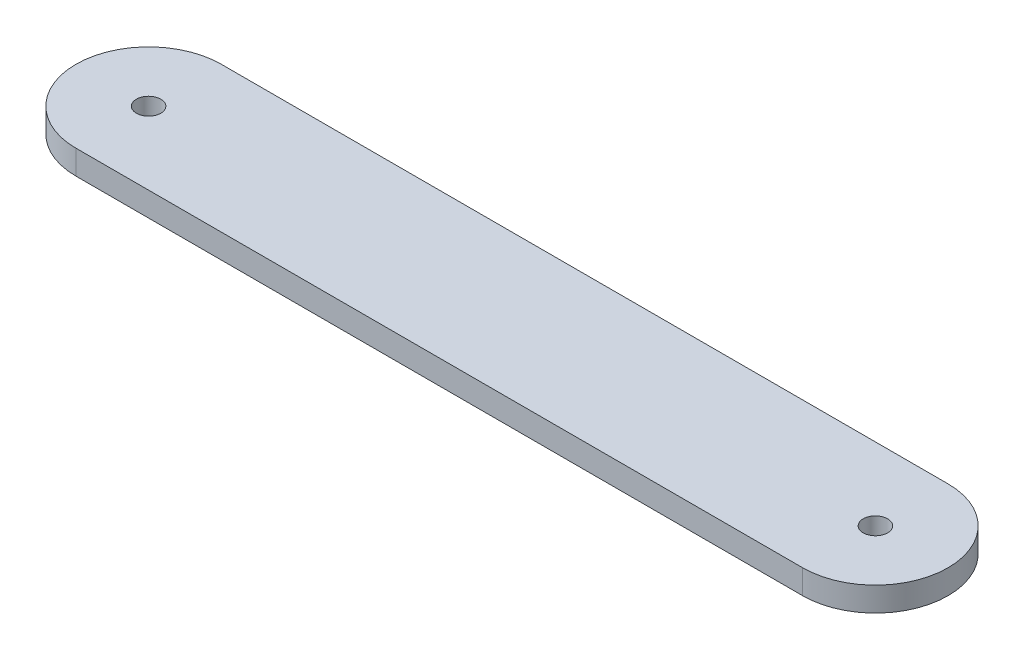
from build123d import *

# Parameters (mm, degrees)
BOSS_EXTRUDE1_DEPTH  = 3.175
M3_CLEARANCE_HOLE1_D = 3.2


with BuildPart() as part:
    # Sketch1 → Boss-Extrude1 (new body)
    with BuildSketch(Plane(origin=(0, 0, 0), x_dir=(1, 0, 0), z_dir=(0, 1, 0))):
        with BuildLine():
            Line((-47.625, 9.525), (47.625, 9.525))
            ThreePointArc((47.625, 9.525), (57.15, 0), (47.625, -9.525))
            Line((47.625, -9.525), (-47.625, -9.525))
            ThreePointArc((-47.625, -9.525), (-57.15, 0), (-47.625, 9.525))
        make_face()
    extrude(amount=BOSS_EXTRUDE1_DEPTH)

    # M3 Clearance Hole1 (through all)
    with Locations(Plane(origin=(0, 3.175, 0), x_dir=(1, 0, 0), z_dir=(0, 1, 0))):
        with Locations((-47.625, 0), (47.625, 0)):
            Hole(M3_CLEARANCE_HOLE1_D / 2)


solid = part.part
